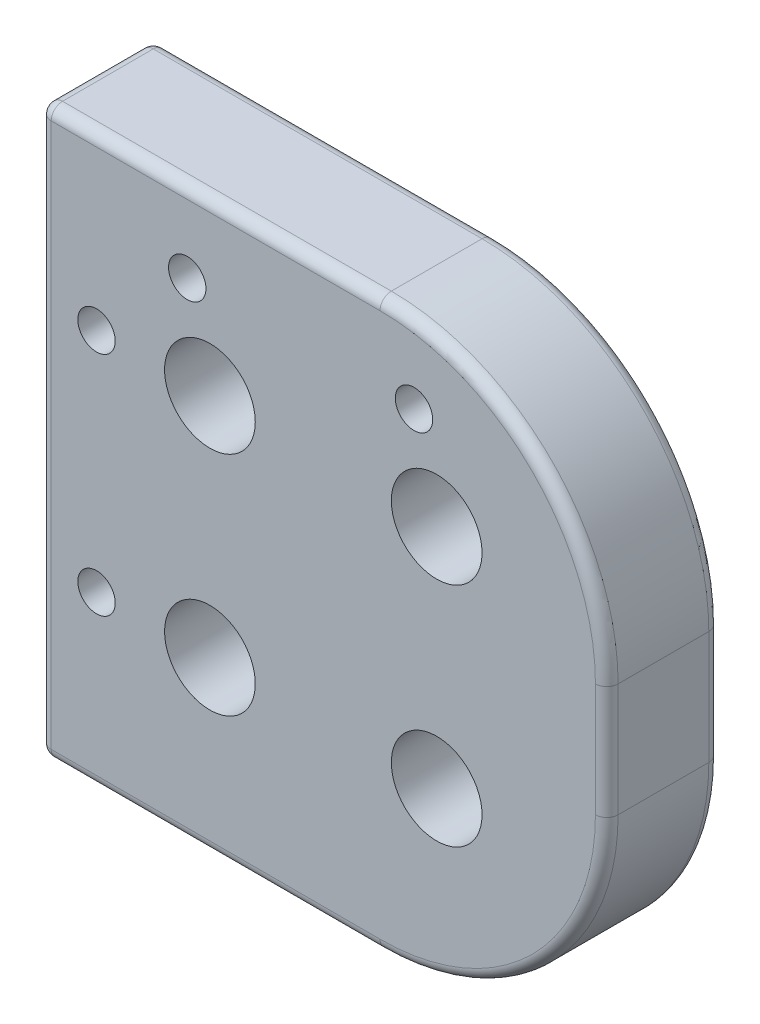
from build123d import *

# Parameters (mm, degrees)
SKETCH_1_W          = 50
SKETCH_1_H          = 50
EXTRUDE_1_DEPTH     = 10
FILLET_1_R          = 20
FILLET_2_R          = 1
SKETCH_3_R          = 4
CUT_EXTRUDE_2_DEPTH = 10
SKETCH_4_R          = 1.65
CUT_EXTRUDE_3_DEPTH = 10


with BuildPart() as part:
    # 草图1 → 凸台-拉伸1 (new body)
    with BuildSketch(Plane.XY):
        Rectangle(SKETCH_1_W, SKETCH_1_H)
    extrude(amount=EXTRUDE_1_DEPTH)

    # 圆角1
    fillet_1_edges = [part.edges().sort_by_distance(p)[0] for p in [
        (25, -25, 5),
        (25, 25, 5),
    ]]
    fillet(fillet_1_edges, radius=FILLET_1_R)

    # 圆角2
    fillet_2_edges = [part.edges().sort_by_distance(p)[0] for p in [
        (-10, -25, 0),
        (-10, -25, 10),
        (-25, 0, 0),
        (-10, 25, 0),
        (-10, 25, 10),
        (-25, 0, 10),
        (-25, -25, 5),
        (-25, 25, 5),
        (19.142135624, -19.142135624, 0),
        (25, 0, 0),
        (19.142135624, 19.142135624, 0),
        (19.142135624, -19.142135624, 10),
        (25, 0, 10),
        (19.142135624, 19.142135624, 10),
    ]]
    fillet(fillet_2_edges, radius=FILLET_2_R)

    # 草图3 → 切除-拉伸2 (cut)
    with BuildSketch(Plane.XY.offset(10)):
        with Locations((-10, 10)):
            Circle(SKETCH_3_R)
        with Locations((10, 10)):
            Circle(SKETCH_3_R)
        with Locations((10, -10)):
            Circle(SKETCH_3_R)
        with Locations((-10, -10)):
            Circle(SKETCH_3_R)
    extrude(amount=-CUT_EXTRUDE_2_DEPTH, mode=Mode.SUBTRACT)

    # 草图4 → 切除-拉伸3 (cut)
    with BuildSketch(Plane.XY.offset(10)):
        with Locations((-20, -10)):
            Circle(SKETCH_4_R)
        with Locations((-20, 10)):
            Circle(SKETCH_4_R)
        with Locations((-12, 18)):
            Circle(SKETCH_4_R)
        with Locations((8, 18)):
            Circle(SKETCH_4_R)
    extrude(amount=-CUT_EXTRUDE_3_DEPTH, mode=Mode.SUBTRACT)


solid = part.part
